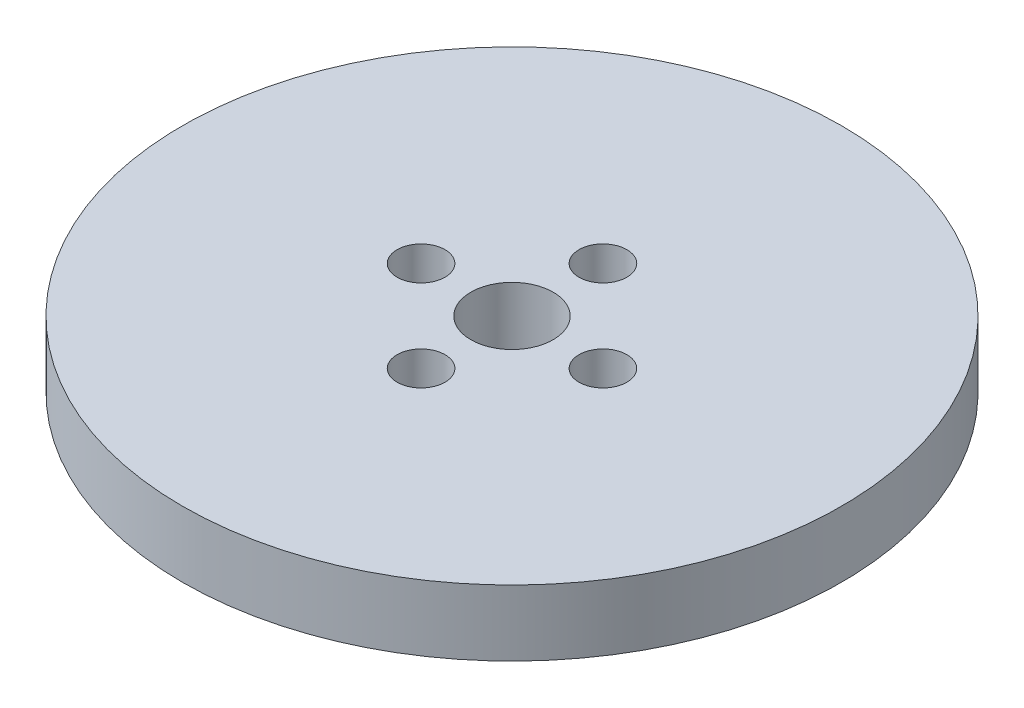
from build123d import *

# Parameters (mm, degrees)
SKETCH1_R           = 40
BOSS_EXTRUDE1_DEPTH = 8
SKETCH2_R           = 5
CUT_EXTRUDE1_DEPTH  = 58.131427428
SKETCH3_R           = 2.904995581
CUT_EXTRUDE2_DEPTH  = 6.560332369
CIRPATTERN1_COUNT   = 4


with BuildPart() as part:
    # Sketch1 → Boss-Extrude1 (new body)
    with BuildSketch(Plane(origin=(0, 0, 0), x_dir=(1, 0, 0), z_dir=(0, 1, 0))):
        Circle(SKETCH1_R)
    extrude(amount=BOSS_EXTRUDE1_DEPTH)

    # Sketch2 → Cut-Extrude1 (cut, through all)
    with BuildSketch(Plane(origin=(0, 0, 0), x_dir=(1, 0, 0), z_dir=(0, 1, 0))):
        Circle(SKETCH2_R)
    extrude(amount=CUT_EXTRUDE1_DEPTH, mode=Mode.SUBTRACT)

    # Sketch3 → Cut-Extrude2 (cut)
    with BuildSketch(Plane(origin=(0, 8, 0), x_dir=(1, 0, 0), z_dir=(0, 1, 0))):
        with Locations((-11.037292591, 0)):
            Circle(SKETCH3_R)
    cut_extrude2 = extrude(amount=-CUT_EXTRUDE2_DEPTH, mode=Mode.SUBTRACT)

    # CirPattern1: Cut-Extrude2 ×4 about axis
    cirpattern1_axis = Axis((0, 0, 0), (0, 1, 0))
    for i in range(1, CIRPATTERN1_COUNT):
        add(cut_extrude2.rotate(cirpattern1_axis, i * 360 / CIRPATTERN1_COUNT), mode=Mode.SUBTRACT)


solid = part.part
